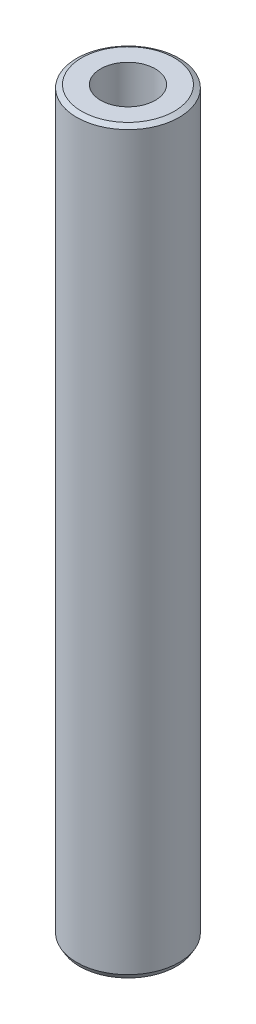
from build123d import *
from OCP.BRepFilletAPI import BRepFilletAPI_MakeChamfer

# Parameters (mm, degrees)
SKETCH1_R           = 20
BOSS_EXTRUDE1_DEPTH = 288.719500473
SKETCH2_R           = 10.668899878
CUT_EXTRUDE1_DEPTH  = 291.101620046
CHAMFER1_SIZE       = 1.102056782
CHAMFER1_SIZE2      = 1.908818339


with BuildPart() as part:
    # Sketch1 → Boss-Extrude1 (new body)
    with BuildSketch(Plane(origin=(0, 0, 0), x_dir=(1, 0, 0), z_dir=(0, 1, 0))):
        Circle(SKETCH1_R)
    extrude(amount=BOSS_EXTRUDE1_DEPTH)

    # Sketch2 → Cut-Extrude1 (cut, through all)
    with BuildSketch(Plane(origin=(0, 0, 0), x_dir=(1, 0, 0), z_dir=(0, 1, 0))):
        Circle(SKETCH2_R)
    extrude(amount=CUT_EXTRUDE1_DEPTH, mode=Mode.SUBTRACT)

    # Chamfer1: one chamfer whose edges measure the first distance from different faces: ONE call of the kernel's chamfer builder (chamfer() names one face for all edges)
    chamfer1_edges_1 = [part.edges().sort_by_distance(p)[0] for p in [
        (-20, 288.719500473, 0),
    ]]
    chamfer1_side_1 = [part.faces().sort_by_distance(p)[0] for p in [
        (-20, 144.359750237, 0),
    ]]
    chamfer1_edges_2 = [part.edges().sort_by_distance(p)[0] for p in [
        (-20, 0, 0),
    ]]
    chamfer1_side_2 = [part.faces().sort_by_distance(p)[0] for p in [
        (-19.434314575, 0, 0),
    ]]
    chamfer1 = BRepFilletAPI_MakeChamfer(part.part.solid().wrapped)
    for e in chamfer1_edges_1:
        chamfer1.Add(CHAMFER1_SIZE, CHAMFER1_SIZE2, e.wrapped, chamfer1_side_1[0].wrapped)  # the first distance lies on this face
    for e in chamfer1_edges_2:
        chamfer1.Add(CHAMFER1_SIZE, CHAMFER1_SIZE2, e.wrapped, chamfer1_side_2[0].wrapped)  # the first distance lies on this face
    add(Compound.cast(chamfer1.Shape()), mode=Mode.REPLACE)


solid = part.part
